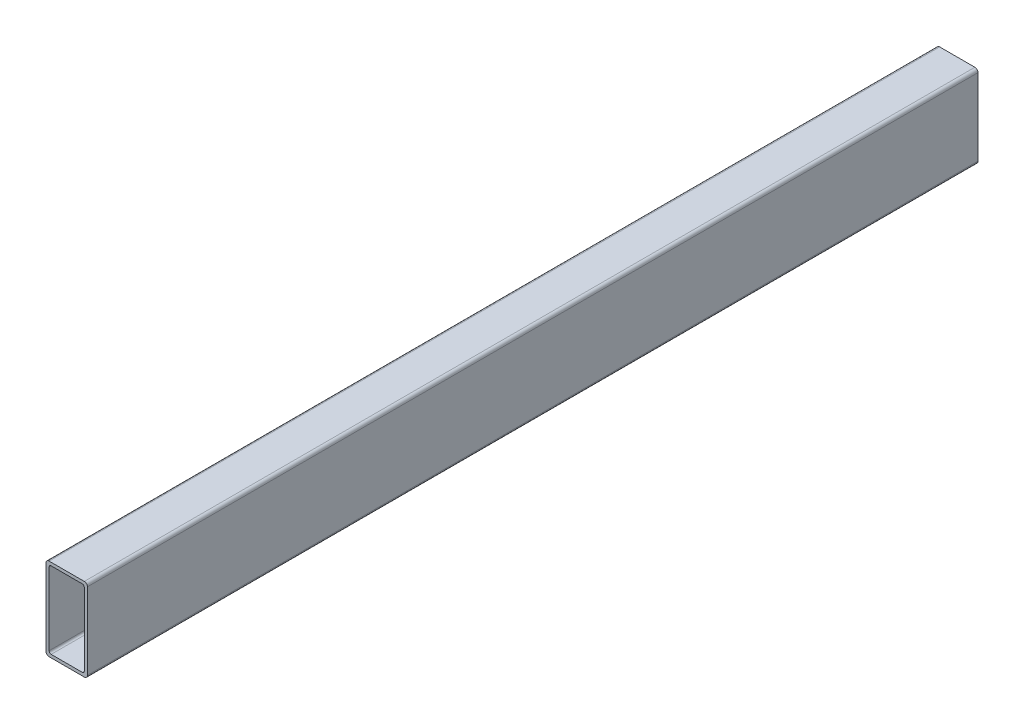
from build123d import *

# Parameters (mm, degrees)
EXTRUDE_1_DEPTH = 215


# Read off the part's stored shape, not the designer's step: Бобышка-Вытянуть1
with BuildPart() as part:
    # Бобышка-Вытянуть1 outline → Бобышка-Вытянуть1 (new body)
    with BuildSketch(Plane.XY):
        with BuildLine():
            ThreePointArc((20, 38.5), (19.560660172, 39.560660172), (18.5, 40))
            Line((18.5, 40), (1.5, 40))
            ThreePointArc((1.5, 40), (0.439339828, 39.560660172), (0, 38.5))
            Line((0, 38.5), (0, 1.5))
            ThreePointArc((0, 1.5), (0.439339828, 0.439339828), (1.5, 0))
            Line((1.5, 0), (18.5, 0))
            ThreePointArc((18.5, 0), (19.560660172, 0.439339828), (20, 1.5))
            Line((20, 1.5), (20, 38.5))
        make_face()
        with BuildLine():
            Line((18.5, 37.5), (18.5, 2.5))
            ThreePointArc((18.5, 2.5), (18.207106781, 1.792893219), (17.5, 1.5))
            Line((17.5, 1.5), (2.5, 1.5))
            ThreePointArc((2.5, 1.5), (1.792893219, 1.792893219), (1.5, 2.5))
            Line((1.5, 2.5), (1.5, 37.5))
            ThreePointArc((1.5, 37.5), (1.792893219, 38.207106781), (2.5, 38.5))
            Line((2.5, 38.5), (17.5, 38.5))
            ThreePointArc((17.5, 38.5), (18.207106781, 38.207106781), (18.5, 37.5))
        make_face(mode=Mode.SUBTRACT)
    extrude(amount=EXTRUDE_1_DEPTH)

    # Зеркальное отражение2: part across plane


with BuildPart() as part_1:
    add(part.part)
    add(part.part.mirror(Plane(origin=(18.5, 38.5, 0), x_dir=(1, 0, 0), z_dir=(0, 0, -1))))


solid = part_1.part
